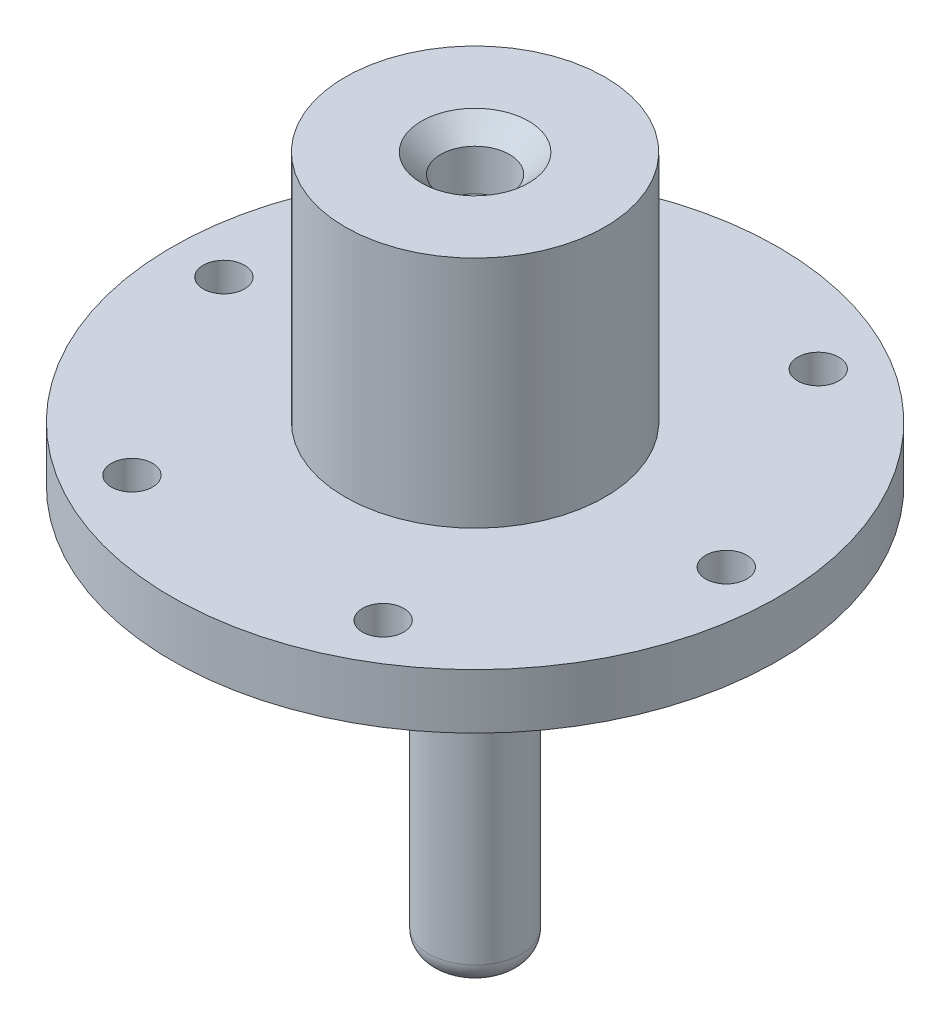
from build123d import *

# Parameters (mm, degrees)
SKETCH5_R                      = 24
SKETCH5_R_2                    = 21
CUT_EXTRUDE1_DEPTH             = 3
F_3_16_0_1875_DIAMETER_HOLE1_D = 4.7625
CIRPATTERN1_COUNT              = 6


with BuildPart() as part:
    # Sketch1 → Revolve1 (revolve)
    with BuildSketch(Plane.XY):
        with BuildLine():
            Line((0, 0), (-15, 0))
            Line((-15, 0), (-15, -27))
            Line((-15, -27), (-35, -27))
            Line((-35, -27), (-35, -33.35))
            Line((-35, -33.35), (-16, -33.35))
            Line((-16, -33.35), (-16, -35.85))
            Line((-16, -35.85), (-10, -35.85))
            Line((-10, -35.85), (-10, -45.35))
            Line((-10, -45.35), (-5.3467, -50.0033))
            Line((-5.3467, -50.0033), (-5.3467, -77.5033))
            ThreePointArc((-5.3467, -77.5033), (-4.614466953, -79.271066953), (-2.8467, -80.0033))
            Line((-2.8467, -80.0033), (0, -80.0033))
            Line((0, -80.0033), (0, 0))
        make_face()
    revolve(axis=Axis((0, -80.0033, 0), (0, 1, 0)))

    # Sketch4 → 1/16 NPT Tapped Hole1 (revolve, cut)
    with BuildSketch(Plane(origin=(0, 0, 0), x_dir=(0, 0, 1), z_dir=(1, 0, 0))):
        Polygon((0, 0), (0, 78.846685027), (3.0734, 77), (3.0734, 6.89), (3.829121997, 6.89), (3.968877, 2.222373), (6.19125, 0), align=None)
    revolve(axis=Axis((0, 6.35, 0), (0, -1, 0)), mode=Mode.SUBTRACT)

    # Sketch5 → Cut-Extrude1 (cut)
    with BuildSketch(Plane(origin=(0, -33.35, 0), x_dir=(-1, 0, 0), z_dir=(0, -1, 0))):
        Circle(SKETCH5_R)
        Circle(SKETCH5_R_2, mode=Mode.SUBTRACT)
    extrude(amount=-CUT_EXTRUDE1_DEPTH, mode=Mode.SUBTRACT)

    # 3/16 (0.1875) Diameter Hole1 (through all)
    with Locations(Plane(origin=(0, -27, 0), x_dir=(1, 0, 0), z_dir=(0, 1, 0))):
        with Locations((29, 0)):
            f_3_16_0_1875_diameter_hole1 = Hole(F_3_16_0_1875_DIAMETER_HOLE1_D / 2)

    # CirPattern1: 3/16 (0.1875) Diameter Hole1 ×6 about axis
    cirpattern1_axis = Axis((0, -80.0033, 0), (0, -1, 0))
    for i in range(1, CIRPATTERN1_COUNT):
        add(f_3_16_0_1875_diameter_hole1.rotate(cirpattern1_axis, i * 360 / CIRPATTERN1_COUNT), mode=Mode.SUBTRACT)


solid = part.part
